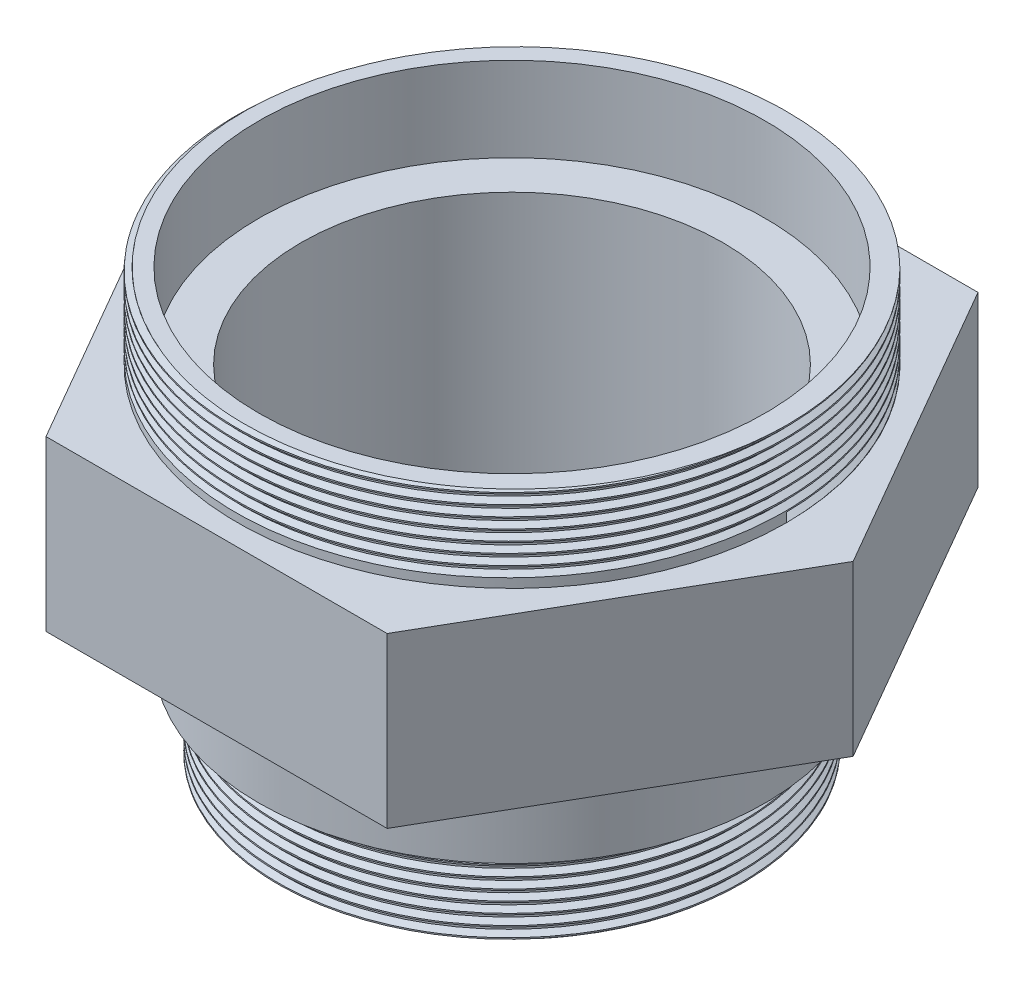
from build123d import *

# Parameters (mm, degrees)
SKETCH1_R               = 5.5
BOSS_EXTRUDE1_DEPTH     = 4
SKETCH1_3_R             = 6
BOSS_EXTRUDE2_DEPTH     = 2
BOSS_EXTRUDE3_DEPTH     = 4
BOSS_EXTRUDE4_START     = 6
SKETCH1_5_R             = 6.5
SKETCH1_5_R_2           = 6
BOSS_EXTRUDE4_DEPTH     = 6
THREAD1_PITCH           = 0.25
THREAD2_PITCH           = 0.25
CUT_EXTRUDE1_DEPTH      = 15.640127675
CUT_EXTRUDE1_DEPTH_BACK = 15.640127675
SKETCH7_R               = 5


with BuildPart() as part:
    # Sketch1 → Boss-Extrude1 (new body)
    with BuildSketch(Plane(origin=(0, 0, 0), x_dir=(1, 0, 0), z_dir=(0, 1, 0))):
        with Locations(Location((0, 0, 0), (0, 0, 270))):
            Circle(SKETCH1_R)
    extrude(amount=-BOSS_EXTRUDE1_DEPTH)

    # Sketch1<3> → Boss-Extrude2 (add)
    with BuildSketch(Plane(origin=(0, 0, 0), x_dir=(1, 0, 0), z_dir=(0, 1, 0))):
        with Locations(Location((0, 0, 0), (0, 0, 270))):
            Circle(SKETCH1_3_R)
    extrude(amount=-BOSS_EXTRUDE2_DEPTH)

    # Sketch1<4> → Boss-Extrude3 (add)
    with BuildSketch(Plane(origin=(0, 0, 0), x_dir=(1, 0, 0), z_dir=(0, 1, 0))):
        Polygon((8.082903769, 0), (4.041451884, 7), (-4.041451884, 7), (-8.082903769, 0), (-4.041451884, -7), (4.041451884, -7), align=None)
    extrude(amount=BOSS_EXTRUDE3_DEPTH)

    # Sketch1<5> → Boss-Extrude4 (add)
    with BuildSketch(Plane(origin=(0, 0, 0), x_dir=(1, 0, 0), z_dir=(0, 1, 0)).offset(BOSS_EXTRUDE4_START)):
        with Locations(Location((0, 0, 0), (0, 0, 270))):
            Circle(SKETCH1_5_R)
        with Locations(Location((0, 0, 0), (0, 0, 270))):
            Circle(SKETCH1_5_R_2, mode=Mode.SUBTRACT)
    extrude(amount=-BOSS_EXTRUDE4_DEPTH)

    # Thread1: the profile of Thread Profile1 profile screwed along a right-hand helix of 8 turns, 6 arcs to a turn; built about Z, then put on its axis
    thread1_z = Axis((0, 0, 0), (0, 0, 1))
    thread1_corners = [(5.5003, 0, -0.000173205), (5.5003, 0, 0.218923204), (5.364683531, 0, 0.140625), (5.364683531, 0, 0.078125)]
    with BuildLine(mode=Mode.PRIVATE) as thread1_profile:
        Line(thread1_corners[0], thread1_corners[1])
        Line(thread1_corners[1], thread1_corners[2])
        Line(thread1_corners[2], thread1_corners[3])
        Line(thread1_corners[3], thread1_corners[0])
    thread1_cap = Face(thread1_profile.wire())
    thread1_turn_angles = [0, 30, 60, 90, 120, 150, 180, 210, 240, 270, 300, 330, 360]
    thread1_turn_weights = [1, 0.8660254037844387, 1, 0.8660254037844387, 1, 0.8660254037844387, 1, 0.8660254037844387, 1, 0.8660254037844387, 1, 0.8660254037844387, 1]
    thread1_turn_rails = [Edge.make_bspline([Vector(p[0], p[1], 0).rotate(thread1_z, thread1_turn_angles[k]) / thread1_turn_weights[k] + Vector(0, 0, p[2] + THREAD1_PITCH * thread1_turn_angles[k] / 360) for k in range(13)], [0, 0, 0, 1, 1, 2, 2, 3, 3, 4, 4, 5, 5, 6, 6, 6], 2, thread1_turn_weights) for p in thread1_corners]
    thread1_turn_sides = [Face.make_surface_from_curves(thread1_turn_rails[p[0]], thread1_turn_rails[p[1]]) for p in [(0, 1), (1, 2), (2, 3), (3, 0)]]
    thread1 = Plane(origin=(0, -2, 0), x_dir=(-1, 0, 0), z_dir=(0, -1, 0)) * Solid(Shell([*[p.moved(Location((0, 0, THREAD1_PITCH * i))) for i in range(8) for p in thread1_turn_sides], thread1_cap, thread1_cap.rotate(thread1_z, 2880).moved(Location((0, 0, THREAD1_PITCH * 2880 / 360)))]))
    add(thread1, mode=Mode.SUBTRACT)

    # Thread2: the profile of Thread Profile2 profile screwed along a right-hand helix of 8 turns, 6 arcs to a turn; built about Z, then put on its axis
    thread2_z = Axis((0, 0, 0), (0, 0, 1))
    thread2_corners = [(6.5003, 0, -0.000173205), (6.5003, 0, 0.218923204), (6.364683531, 0, 0.140625), (6.364683531, 0, 0.078125)]
    with BuildLine(mode=Mode.PRIVATE) as thread2_profile:
        Line(thread2_corners[0], thread2_corners[1])
        Line(thread2_corners[1], thread2_corners[2])
        Line(thread2_corners[2], thread2_corners[3])
        Line(thread2_corners[3], thread2_corners[0])
    thread2_cap = Face(thread2_profile.wire())
    thread2_turn_angles = [0, 30, 60, 90, 120, 150, 180, 210, 240, 270, 300, 330, 360]
    thread2_turn_weights = [1, 0.8660254037844387, 1, 0.8660254037844387, 1, 0.8660254037844387, 1, 0.8660254037844387, 1, 0.8660254037844387, 1, 0.8660254037844387, 1]
    thread2_turn_rails = [Edge.make_bspline([Vector(p[0], p[1], 0).rotate(thread2_z, thread2_turn_angles[k]) / thread2_turn_weights[k] + Vector(0, 0, p[2] + THREAD2_PITCH * thread2_turn_angles[k] / 360) for k in range(13)], [0, 0, 0, 1, 1, 2, 2, 3, 3, 4, 4, 5, 5, 6, 6, 6], 2, thread2_turn_weights) for p in thread2_corners]
    thread2_turn_sides = [Face.make_surface_from_curves(thread2_turn_rails[p[0]], thread2_turn_rails[p[1]]) for p in [(0, 1), (1, 2), (2, 3), (3, 0)]]
    thread2 = Plane(origin=(0, 4, 0), x_dir=(1, 0, 0), z_dir=(0, 1, 0)) * Solid(Shell([*[p.moved(Location((0, 0, THREAD2_PITCH * i))) for i in range(8) for p in thread2_turn_sides], thread2_cap, thread2_cap.rotate(thread2_z, 2880).moved(Location((0, 0, THREAD2_PITCH * 2880 / 360)))]))
    add(thread2, mode=Mode.SUBTRACT)

    # Sketch7 → Cut-Extrude1 (cut, two sides: drawn at the far end of the back side and taken through both)
    with BuildSketch(Plane.XZ.offset(4).offset(-CUT_EXTRUDE1_DEPTH_BACK)):
        with Locations(Location((0, 0, 0), (0, 0, 90))):
            Circle(SKETCH7_R)
    extrude(amount=CUT_EXTRUDE1_DEPTH + CUT_EXTRUDE1_DEPTH_BACK, mode=Mode.SUBTRACT)


solid = part.part
